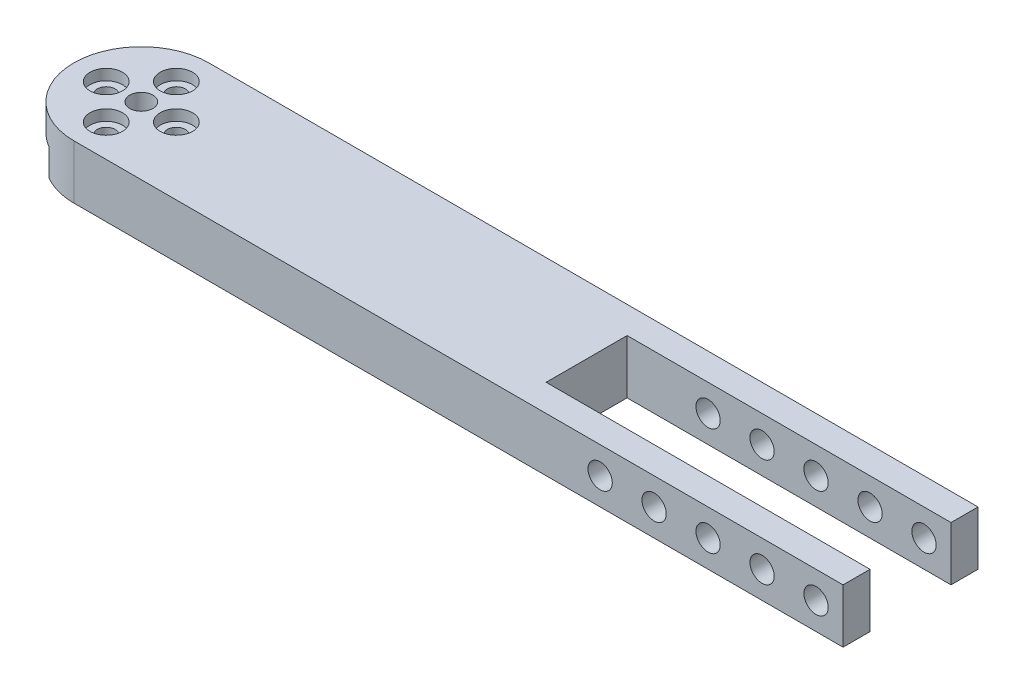
from build123d import *

# Parameters (mm, degrees)
SKETCH1_W              = 250
SKETCH1_H              = 25
BOSS_EXTRUDE1_DEPTH    = 10
CUT_EXTRUDE1_REACH     = 253.446
SKETCH2_R              = 2.15
FILLET1_R              = 12.5
SKETCH3_R              = 2.25
CUT_EXTRUDE2_DEPTH     = 252.445819214
CUT_EXTRUDE5_REACH     = 253.446
SKETCH5_W              = 7.3
SKETCH5_H              = 4
SKETCH6_R              = 10
CUT_EXTRUDE6_DEPTH     = 5
CUT_EXTRUDE7_REACH     = 253.297
SKETCH7_R              = 1.65
CUT_EXTRUDE8_START     = -3.2
CUT_EXTRUDE8_OUTLINE_W = 6
CUT_EXTRUDE8_OUTLINE_H = 6
CUT_EXTRUDE8_DEPTH     = 6.4
SKETCH9_R              = 3
CUT_EXTRUDE9_DEPTH     = 2
CUT_EXTRUDE10_DEPTH    = 252.445819214
SKETCH11_R             = 2.25
CUT_EXTRUDE11_DEPTH    = 158.321327226


# Read off the part's stored shape, not the designer's step: Cut-Extrude8
with BuildPart() as part:
    # Sketch1 → Boss-Extrude1 (new body)
    with BuildSketch(Plane(origin=(0, 0, 0), x_dir=(1, 0, 0), z_dir=(0, 1, 0))):
        with Locations((125, 12.5)):
            Rectangle(SKETCH1_W, SKETCH1_H)
    extrude(amount=BOSS_EXTRUDE1_DEPTH)

    # Sketch2 → Cut-Extrude1 (cut, up to next)
    with BuildSketch(Plane(origin=(0, 10, 0), x_dir=(1, 0, 0), z_dir=(0, 1, 0)), mode=Mode.PRIVATE) as cut_extrude1_sk1:
        with Locations(Location((12.5, 12.5, 0), (0, 0, 270))):
            Circle(SKETCH2_R)
    cut_extrude1_tool1 = extrude(cut_extrude1_sk1.sketch, amount=-CUT_EXTRUDE1_REACH, mode=Mode.PRIVATE) & part.part
    add(cut_extrude1_tool1.solids().sort_by_distance((12.5, 10, -12.5))[0], mode=Mode.SUBTRACT)

    # Fillet1
    fillet1_edges = [part.edges().sort_by_distance(p)[0] for p in [
        (0, 5, 0),
        (0, 5, -25),
    ]]
    fillet(fillet1_edges, radius=FILLET1_R - 0.0001)  # a hair under: the kernel refuses the full size

    # Sketch3 → Cut-Extrude2 (cut, through all)
    with BuildSketch(Plane(origin=(0, 0, -25), x_dir=(-1, 0, 0), z_dir=(0, 0, -1))):
        with Locations((-244.5, 5)):
            Circle(SKETCH3_R)
        with Locations((-230.5, 5)):
            Circle(SKETCH3_R)
    extrude(amount=-CUT_EXTRUDE2_DEPTH, mode=Mode.SUBTRACT)

    # Sketch5 → Cut-Extrude5 (cut, up to next)
    with BuildSketch(Plane(origin=(0, 10, 0), x_dir=(1, 0, 0), z_dir=(0, 1, 0)), mode=Mode.PRIVATE) as cut_extrude5_sk1:
        with Locations((244.5, 19)):
            Rectangle(SKETCH5_W, SKETCH5_H)
    cut_extrude5_tool1 = extrude(cut_extrude5_sk1.sketch, amount=-CUT_EXTRUDE5_REACH, mode=Mode.PRIVATE) & part.part
    # Sketch5 → Cut-Extrude5 (cut, up to next)
    with BuildSketch(Plane(origin=(0, 10, 0), x_dir=(1, 0, 0), z_dir=(0, 1, 0)), mode=Mode.PRIVATE) as cut_extrude5_sk2:
        with Locations((244.5, 6)):
            Rectangle(SKETCH5_W, SKETCH5_H)
    cut_extrude5_tool2 = extrude(cut_extrude5_sk2.sketch, amount=-CUT_EXTRUDE5_REACH, mode=Mode.PRIVATE) & part.part
    # Sketch5 → Cut-Extrude5 (cut, up to next)
    with BuildSketch(Plane(origin=(0, 10, 0), x_dir=(1, 0, 0), z_dir=(0, 1, 0)), mode=Mode.PRIVATE) as cut_extrude5_sk3:
        with Locations((230.5, 19)):
            Rectangle(SKETCH5_W, SKETCH5_H)
    cut_extrude5_tool3 = extrude(cut_extrude5_sk3.sketch, amount=-CUT_EXTRUDE5_REACH, mode=Mode.PRIVATE) & part.part
    # Sketch5 → Cut-Extrude5 (cut, up to next)
    with BuildSketch(Plane(origin=(0, 10, 0), x_dir=(1, 0, 0), z_dir=(0, 1, 0)), mode=Mode.PRIVATE) as cut_extrude5_sk4:
        with Locations((230.5, 6)):
            Rectangle(SKETCH5_W, SKETCH5_H)
    cut_extrude5_tool4 = extrude(cut_extrude5_sk4.sketch, amount=-CUT_EXTRUDE5_REACH, mode=Mode.PRIVATE) & part.part
    add(cut_extrude5_tool1.solids().sort_by_distance((244.5, 10, -19))[0], mode=Mode.SUBTRACT)
    add(cut_extrude5_tool2.solids().sort_by_distance((244.5, 10, -6))[0], mode=Mode.SUBTRACT)
    add(cut_extrude5_tool3.solids().sort_by_distance((230.5, 10, -19))[0], mode=Mode.SUBTRACT)
    add(cut_extrude5_tool4.solids().sort_by_distance((230.5, 10, -6))[0], mode=Mode.SUBTRACT)

    # Sketch6 → Cut-Extrude6 (cut)
    with BuildSketch(Plane.XZ):
        with Locations(Location((12.5, -12.5, 0), (0, 0, 270))):
            Circle(SKETCH6_R)
    extrude(amount=-CUT_EXTRUDE6_DEPTH, mode=Mode.SUBTRACT)

    # Sketch7 → Cut-Extrude7 (cut, up to next)
    with BuildSketch(Plane.XZ.offset(-5), mode=Mode.PRIVATE) as cut_extrude7_sk1:
        with Locations(Location((12.5, -6, 0), (0, 0, 270))):
            Circle(SKETCH7_R)
    cut_extrude7_tool1 = extrude(cut_extrude7_sk1.sketch, amount=-CUT_EXTRUDE7_REACH, mode=Mode.PRIVATE) & part.part
    # Sketch7 → Cut-Extrude7 (cut, up to next)
    with BuildSketch(Plane.XZ.offset(-5), mode=Mode.PRIVATE) as cut_extrude7_sk2:
        with Locations(Location((19, -12.5, 0), (0, 0, 270))):
            Circle(SKETCH7_R)
    cut_extrude7_tool2 = extrude(cut_extrude7_sk2.sketch, amount=-CUT_EXTRUDE7_REACH, mode=Mode.PRIVATE) & part.part
    # Sketch7 → Cut-Extrude7 (cut, up to next)
    with BuildSketch(Plane.XZ.offset(-5), mode=Mode.PRIVATE) as cut_extrude7_sk3:
        with Locations(Location((12.5, -19, 0), (0, 0, 270))):
            Circle(SKETCH7_R)
    cut_extrude7_tool3 = extrude(cut_extrude7_sk3.sketch, amount=-CUT_EXTRUDE7_REACH, mode=Mode.PRIVATE) & part.part
    # Sketch7 → Cut-Extrude7 (cut, up to next)
    with BuildSketch(Plane.XZ.offset(-5), mode=Mode.PRIVATE) as cut_extrude7_sk4:
        with Locations(Location((6, -12.5, 0), (0, 0, 270))):
            Circle(SKETCH7_R)
    cut_extrude7_tool4 = extrude(cut_extrude7_sk4.sketch, amount=-CUT_EXTRUDE7_REACH, mode=Mode.PRIVATE) & part.part
    add(cut_extrude7_tool1.solids().sort_by_distance((12.5, 5, -6))[0], mode=Mode.SUBTRACT)
    add(cut_extrude7_tool2.solids().sort_by_distance((19, 5, -12.5))[0], mode=Mode.SUBTRACT)
    add(cut_extrude7_tool3.solids().sort_by_distance((12.5, 5, -19))[0], mode=Mode.SUBTRACT)
    add(cut_extrude7_tool4.solids().sort_by_distance((6, 5, -12.5))[0], mode=Mode.SUBTRACT)

    # Cut-Extrude8 outline → Cut-Extrude8 (cut)
    with BuildSketch(Plane(origin=(0, 0, 0), x_dir=(0.707106781186548, 0, -0.707106781186547), z_dir=(0.707106781186547, 0, 0.707106781186548)).offset(CUT_EXTRUDE8_START)):
        with Locations((7, 2)):
            Rectangle(CUT_EXTRUDE8_OUTLINE_W, CUT_EXTRUDE8_OUTLINE_H)
    extrude(amount=CUT_EXTRUDE8_DEPTH, mode=Mode.SUBTRACT)

    # Sketch9 → Cut-Extrude9 (cut)
    with BuildSketch(Plane(origin=(0, 10, 0), x_dir=(1, 0, 0), z_dir=(0, 1, 0))):
        with Locations(Location((12.5, 19, 0), (0, 0, 270))):
            Circle(SKETCH9_R)
        with Locations(Location((19, 12.5, 0), (0, 0, 270))):
            Circle(SKETCH9_R)
        with Locations(Location((12.5, 6, 0), (0, 0, 270))):
            Circle(SKETCH9_R)
        with Locations(Location((6, 12.5, 0), (0, 0, 270))):
            Circle(SKETCH9_R)
    extrude(amount=-CUT_EXTRUDE9_DEPTH, mode=Mode.SUBTRACT)

    # Sketch10 → Cut-Extrude10 (cut, through all)
    with BuildSketch(Plane(origin=(0, 10, 0), x_dir=(1, 0, 0), z_dir=(0, 1, 0))):
        Polygon((95, 5), (155, 5), (155, 0), (250, 0), (250, 25), (155, 25), (155, 20), (95, 20), align=None)
    extrude(amount=-CUT_EXTRUDE10_DEPTH, mode=Mode.SUBTRACT)

    # Sketch11 → Cut-Extrude11 (cut, through all)
    with BuildSketch(Plane.XY):
        with Locations((150, 5)):
            Circle(SKETCH11_R)
        with Locations((140, 5)):
            Circle(SKETCH11_R)
        with Locations((130, 5)):
            Circle(SKETCH11_R)
        with Locations((120, 5)):
            Circle(SKETCH11_R)
        with Locations((110, 5)):
            Circle(SKETCH11_R)
    extrude(amount=-CUT_EXTRUDE11_DEPTH, mode=Mode.SUBTRACT)


solid = part.part
